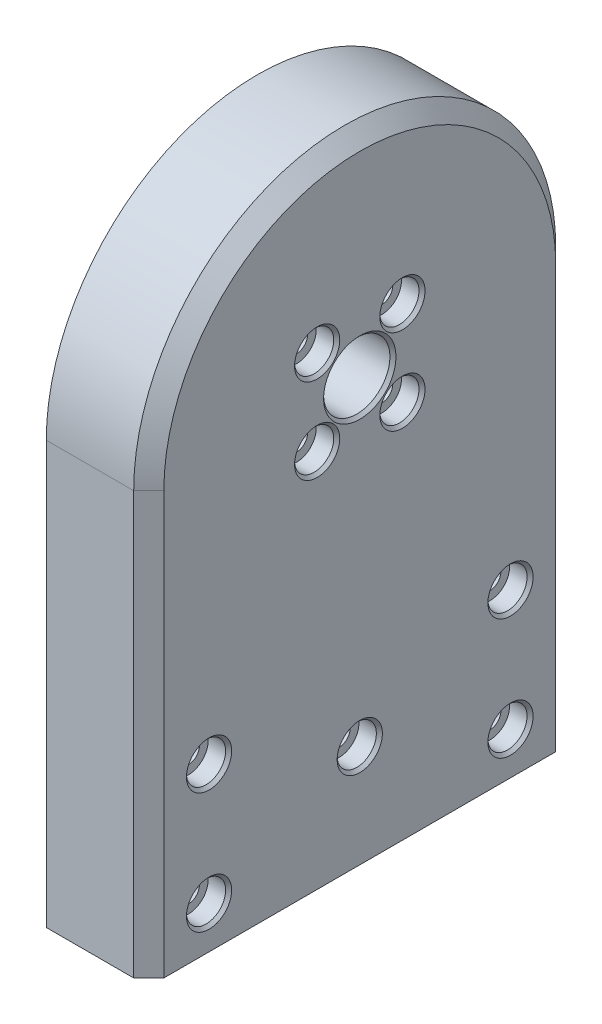
from build123d import *

# Parameters (mm, degrees)
BOSS_EXTRUDE1_DEPTH                           = 17
BOSS_EXTRUDE2_START                           = -0.5
BOSS_EXTRUDE2_DEPTH                           = 0.5
CBORE_START                                   = -0.5
CBORE_FOR_M3_HEX_SOCKET_HEAD_CAP_SCR_2_R      = 1.8
CBORE_FOR_M3_HEX_SOCKET_HEAD_CAP_SCREW1_DEPTH = 17.5
CBORE_START_2                                 = 13.6
CBORE_FOR_M3_HEX_SOCKET_HEAD_CAP_SCR_3_O_R    = 3.25
CBORE_FOR_M3_HEX_SOCKET_HEAD_CAP_SCR_3_O_R_2  = 1.8
CBORE_FOR_M3_HEX_SOCKET_HEAD_CAP_SCR_3_DEPTH  = 3.4
F_2_5MM_CHAMFER1_SIZE                         = 2.5
F_0_5MM_CHAMFER2_SIZE                         = 0.5


# Read off the part's stored shape, not the designer's step: CBORE for M3 Hex Socket Head Cap Screw1
with BuildPart() as part:
    # Sketch1 → Boss-Extrude1 (new body)
    with BuildSketch(Plane(origin=(0, 0, 0), x_dir=(0, 0, -1), z_dir=(1, 0, 0))):
        with BuildLine():
            ThreePointArc((-17, 0), (0, 17), (17, 0))
            Line((17, 0), (35, 0))
            ThreePointArc((35, 0), (0, 35), (-35, 0))
            Line((-35, 0), (-17, 0))
        make_face()
        with BuildLine():
            Line((35, 0), (17, 0))
            ThreePointArc((17, 0), (0, -17), (-17, 0))
            Line((-17, 0), (-35, 0))
            ThreePointArc((-35, 0), (0, -35), (35, 0))
        make_face()
        with BuildLine():
            ThreePointArc((-5.5, 0), (0, 5.5), (5.5, 0))
            Line((5.5, 0), (17, 0))
            ThreePointArc((17, 0), (0, 17), (-17, 0))
            Line((-17, 0), (-5.5, 0))
        make_face()
        with BuildLine():
            Line((17, 0), (5.5, 0))
            ThreePointArc((5.5, 0), (0, -5.5), (-5.5, 0))
            Line((-5.5, 0), (-17, 0))
            ThreePointArc((-17, 0), (0, -17), (17, 0))
        make_face()
        with BuildLine():
            Line((35, -70), (35, 0))
            ThreePointArc((35, 0), (0, -35), (-35, 0))
            Line((-35, 0), (-35, -70))
            Line((-35, -70), (35, -70))
        make_face()
    extrude(amount=BOSS_EXTRUDE1_DEPTH)

    # Sketch1<4> → Boss-Extrude2 (add)
    with BuildSketch(Plane(origin=(0, 0, 0), x_dir=(0, 0, -1), z_dir=(1, 0, 0)).offset(BOSS_EXTRUDE2_START)):
        with BuildLine():
            ThreePointArc((-5.5, 0), (0, 5.5), (5.5, 0))
            Line((5.5, 0), (17, 0))
            ThreePointArc((17, 0), (0, 17), (-17, 0))
            Line((-17, 0), (-5.5, 0))
        make_face()
        with BuildLine():
            Line((17, 0), (5.5, 0))
            ThreePointArc((5.5, 0), (0, -5.5), (-5.5, 0))
            Line((-5.5, 0), (-17, 0))
            ThreePointArc((-17, 0), (0, -17), (17, 0))
        make_face()
    extrude(amount=BOSS_EXTRUDE2_DEPTH)

    # CBORE for M3 Hex Socket Head Cap Scr 2 → CBORE for M3 Hex Socket Head Cap Screw1 (cut)
    with BuildSketch(Plane.YZ.offset(CBORE_START)):
        with Locations((-63, -25)):
            Circle(CBORE_FOR_M3_HEX_SOCKET_HEAD_CAP_SCR_2_R)
        with Locations((-43, 25)):
            Circle(CBORE_FOR_M3_HEX_SOCKET_HEAD_CAP_SCR_2_R)
        with Locations((-63, 25)):
            Circle(CBORE_FOR_M3_HEX_SOCKET_HEAD_CAP_SCR_2_R)
        with Locations((-43, -25)):
            Circle(CBORE_FOR_M3_HEX_SOCKET_HEAD_CAP_SCR_2_R)
        with Locations((-53, 0)):
            Circle(CBORE_FOR_M3_HEX_SOCKET_HEAD_CAP_SCR_2_R)
        with Locations((7.071067812, 7.071067812)):
            Circle(CBORE_FOR_M3_HEX_SOCKET_HEAD_CAP_SCR_2_R)
        with Locations((-7.071067812, 7.071067812)):
            Circle(CBORE_FOR_M3_HEX_SOCKET_HEAD_CAP_SCR_2_R)
        with Locations((-7.071067812, -7.071067812)):
            Circle(CBORE_FOR_M3_HEX_SOCKET_HEAD_CAP_SCR_2_R)
        with Locations((7.071067812, -7.071067812)):
            Circle(CBORE_FOR_M3_HEX_SOCKET_HEAD_CAP_SCR_2_R)
    extrude(amount=CBORE_FOR_M3_HEX_SOCKET_HEAD_CAP_SCREW1_DEPTH, mode=Mode.SUBTRACT)

    # CBORE for M3 Hex Socket Head Cap Scr 3 o → CBORE for M3 Hex Socket Head Cap Scr 3 (cut)
    # profile 1 of 9: a face of its own
    with BuildSketch(Plane.YZ.offset(CBORE_START_2)):
        with Locations((-63, -25)):
            Circle(CBORE_FOR_M3_HEX_SOCKET_HEAD_CAP_SCR_3_O_R)
        with Locations((-63, -25)):
            Circle(CBORE_FOR_M3_HEX_SOCKET_HEAD_CAP_SCR_3_O_R_2, mode=Mode.SUBTRACT)
    # profile 2 of 9: a face of its own
    with BuildSketch(Plane.YZ.offset(CBORE_START_2)):
        with Locations((-43, 25)):
            Circle(CBORE_FOR_M3_HEX_SOCKET_HEAD_CAP_SCR_3_O_R)
        with Locations((-43, 25)):
            Circle(CBORE_FOR_M3_HEX_SOCKET_HEAD_CAP_SCR_3_O_R_2, mode=Mode.SUBTRACT)
    # profile 3 of 9: a face of its own
    with BuildSketch(Plane.YZ.offset(CBORE_START_2)):
        with Locations((-63, 25)):
            Circle(CBORE_FOR_M3_HEX_SOCKET_HEAD_CAP_SCR_3_O_R)
        with Locations((-63, 25)):
            Circle(CBORE_FOR_M3_HEX_SOCKET_HEAD_CAP_SCR_3_O_R_2, mode=Mode.SUBTRACT)
    # profile 4 of 9: a face of its own
    with BuildSketch(Plane.YZ.offset(CBORE_START_2)):
        with Locations((-43, -25)):
            Circle(CBORE_FOR_M3_HEX_SOCKET_HEAD_CAP_SCR_3_O_R)
        with Locations((-43, -25)):
            Circle(CBORE_FOR_M3_HEX_SOCKET_HEAD_CAP_SCR_3_O_R_2, mode=Mode.SUBTRACT)
    # profile 5 of 9: a face of its own
    with BuildSketch(Plane.YZ.offset(CBORE_START_2)):
        with Locations((-53, 0)):
            Circle(CBORE_FOR_M3_HEX_SOCKET_HEAD_CAP_SCR_3_O_R)
        with Locations((-53, 0)):
            Circle(CBORE_FOR_M3_HEX_SOCKET_HEAD_CAP_SCR_3_O_R_2, mode=Mode.SUBTRACT)
    # profile 6 of 9: a face of its own
    with BuildSketch(Plane.YZ.offset(CBORE_START_2)):
        with Locations((7.071067812, 7.071067812)):
            Circle(CBORE_FOR_M3_HEX_SOCKET_HEAD_CAP_SCR_3_O_R)
        with Locations((7.071067812, 7.071067812)):
            Circle(CBORE_FOR_M3_HEX_SOCKET_HEAD_CAP_SCR_3_O_R_2, mode=Mode.SUBTRACT)
    # profile 7 of 9: a face of its own
    with BuildSketch(Plane.YZ.offset(CBORE_START_2)):
        with Locations((-7.071067812, 7.071067812)):
            Circle(CBORE_FOR_M3_HEX_SOCKET_HEAD_CAP_SCR_3_O_R)
        with Locations((-7.071067812, 7.071067812)):
            Circle(CBORE_FOR_M3_HEX_SOCKET_HEAD_CAP_SCR_3_O_R_2, mode=Mode.SUBTRACT)
    # profile 8 of 9: a face of its own
    with BuildSketch(Plane.YZ.offset(CBORE_START_2)):
        with Locations((-7.071067812, -7.071067812)):
            Circle(CBORE_FOR_M3_HEX_SOCKET_HEAD_CAP_SCR_3_O_R)
        with Locations((-7.071067812, -7.071067812)):
            Circle(CBORE_FOR_M3_HEX_SOCKET_HEAD_CAP_SCR_3_O_R_2, mode=Mode.SUBTRACT)
    # profile 9 of 9: a face of its own
    with BuildSketch(Plane.YZ.offset(CBORE_START_2)):
        with Locations((7.071067812, -7.071067812)):
            Circle(CBORE_FOR_M3_HEX_SOCKET_HEAD_CAP_SCR_3_O_R)
        with Locations((7.071067812, -7.071067812)):
            Circle(CBORE_FOR_M3_HEX_SOCKET_HEAD_CAP_SCR_3_O_R_2, mode=Mode.SUBTRACT)
    extrude(amount=CBORE_FOR_M3_HEX_SOCKET_HEAD_CAP_SCR_3_DEPTH, mode=Mode.SUBTRACT)

    # 2,5mm Chamfer1
    f_2_5mm_chamfer1_edges = [part.edges().sort_by_distance(p)[0] for p in [
        (17, 35, 0),
        (17, -35, 35),
        (17, -35, -35),
    ]]
    chamfer(f_2_5mm_chamfer1_edges, length=F_2_5MM_CHAMFER1_SIZE)

    # 0,5mm Chamfer2
    f_0_5mm_chamfer2_edges = [part.edges().sort_by_distance(p)[0] for p in [
        (0, -64.8, -25),
        (17, -66.25, -25),
        (0, -44.8, 25),
        (17, -46.25, 25),
        (0, -64.8, 25),
        (17, -66.25, 25),
        (0, -44.8, -25),
        (17, -46.25, -25),
        (17, 0, 5.5),
        (0, -54.8, 0),
        (17, -56.25, 0),
        (17, 3.821067812, 7.071067812),
        (-0.5, 5.271067812, 7.071067812),
        (17, -10.321067812, 7.071067812),
        (-0.5, -8.871067812, 7.071067812),
        (17, -10.321067812, -7.071067812),
        (-0.5, -8.871067812, -7.071067812),
        (17, 3.821067812, -7.071067812),
        (-0.5, 5.271067812, -7.071067812),
    ]]
    chamfer(f_0_5mm_chamfer2_edges, length=F_0_5MM_CHAMFER2_SIZE)


solid = part.part
